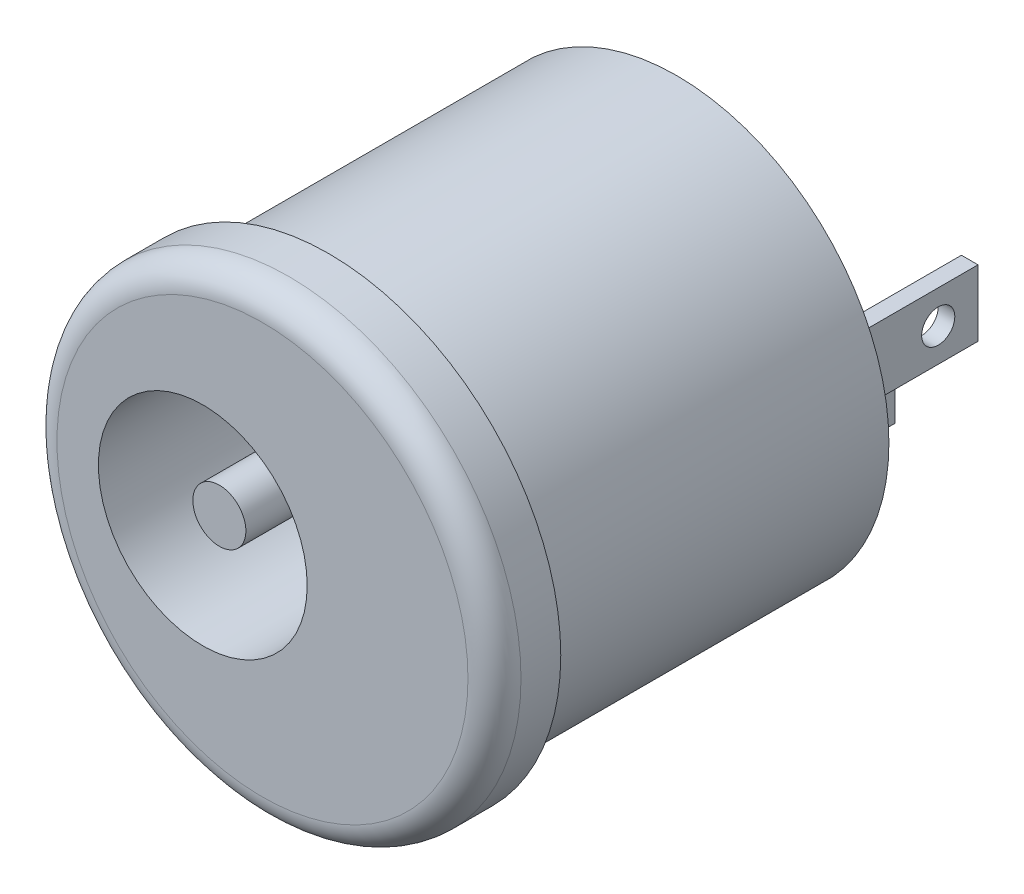
from build123d import *

# Parameters (mm, degrees)
ESQUISSE1_R             = 7
BOSS_EXTRU_1_DEPTH      = 12.5
ESQUISSE2_R             = 7
ESQUISSE2_R_2           = 6.4
ENL_V_MAT_EXTRU_1_DEPTH = 10.5
ESQUISSE4_R             = 3.15
ENL_V_MAT_EXTRU_3_DEPTH = 9
ESQUISSE5_R             = 0.8
BOSS_EXTRU_2_DEPTH      = 8.5
ESQUISSE6_W             = 0.5
ESQUISSE6_H             = 2
BOSS_EXTRU_3_DEPTH      = 5
ESQUISSE7_R             = 0.5
ENL_V_MAT_EXTRU_4_DEPTH = 17.703008034
ESQUISSE8_R             = 0.5
ENL_V_MAT_EXTRU_5_DEPTH = 19.115775351
CONG_7_R                = 0.8


with BuildPart() as part:
    # Esquisse1 → Boss.-Extru.1 (new body)
    with BuildSketch(Plane.XY):
        Circle(ESQUISSE1_R)
    extrude(amount=BOSS_EXTRU_1_DEPTH)

    # Esquisse2 → Enlèv. mat.-Extru.1 (cut)
    with BuildSketch(Plane(origin=(0, 0, 0), x_dir=(-1, 0, 0), z_dir=(0, 0, -1))):
        Circle(ESQUISSE2_R)
        Circle(ESQUISSE2_R_2, mode=Mode.SUBTRACT)
    extrude(amount=-ENL_V_MAT_EXTRU_1_DEPTH, mode=Mode.SUBTRACT)

    # Esquisse4 → Enlèv. mat.-Extru.3 (cut)
    with BuildSketch(Plane.XY.offset(12.5)):
        with Locations((-1.8, 0)):
            Circle(ESQUISSE4_R)
    extrude(amount=-ENL_V_MAT_EXTRU_3_DEPTH, mode=Mode.SUBTRACT)

    # Esquisse5 → Boss.-Extru.2 (add)
    with BuildSketch(Plane.XY.offset(3.5)):
        with Locations((-1.8, 0)):
            Circle(ESQUISSE5_R)
    extrude(amount=BOSS_EXTRU_2_DEPTH)

    # Esquisse6 → Boss.-Extru.3 (add)
    with BuildSketch(Plane(origin=(0, 0, 0), x_dir=(-1, 0, 0), z_dir=(0, 0, -1))):
        with Locations((-3.837439586, 0)):
            Rectangle(ESQUISSE6_W, ESQUISSE6_H)
        with Locations((-1.337227572, -3.389935619)):
            Rectangle(ESQUISSE6_W, ESQUISSE6_H)
    extrude(amount=BOSS_EXTRU_3_DEPTH)

    # Esquisse7 → Enlèv. mat.-Extru.4 (cut, through all)
    with BuildSketch(Plane(origin=(1.587227572, 0, 0), x_dir=(0, 0, -1), z_dir=(1, 0, 0))):
        with Locations((3.8, -3.389935619)):
            Circle(ESQUISSE7_R)
    extrude(amount=-ENL_V_MAT_EXTRU_4_DEPTH, mode=Mode.SUBTRACT)

    # Esquisse8 → Enlèv. mat.-Extru.5 (cut, through all)
    with BuildSketch(Plane(origin=(4.087439586, 0, 0), x_dir=(0, 0, -1), z_dir=(1, 0, 0))):
        with Locations((3.8, 0)):
            Circle(ESQUISSE8_R)
    extrude(amount=-ENL_V_MAT_EXTRU_5_DEPTH, mode=Mode.SUBTRACT)

    # Congé7
    cong_7_edges = [part.edges().sort_by_distance(p)[0] for p in [
        (-7, 0, 12.5),
    ]]
    fillet(cong_7_edges, radius=CONG_7_R)


solid = part.part
